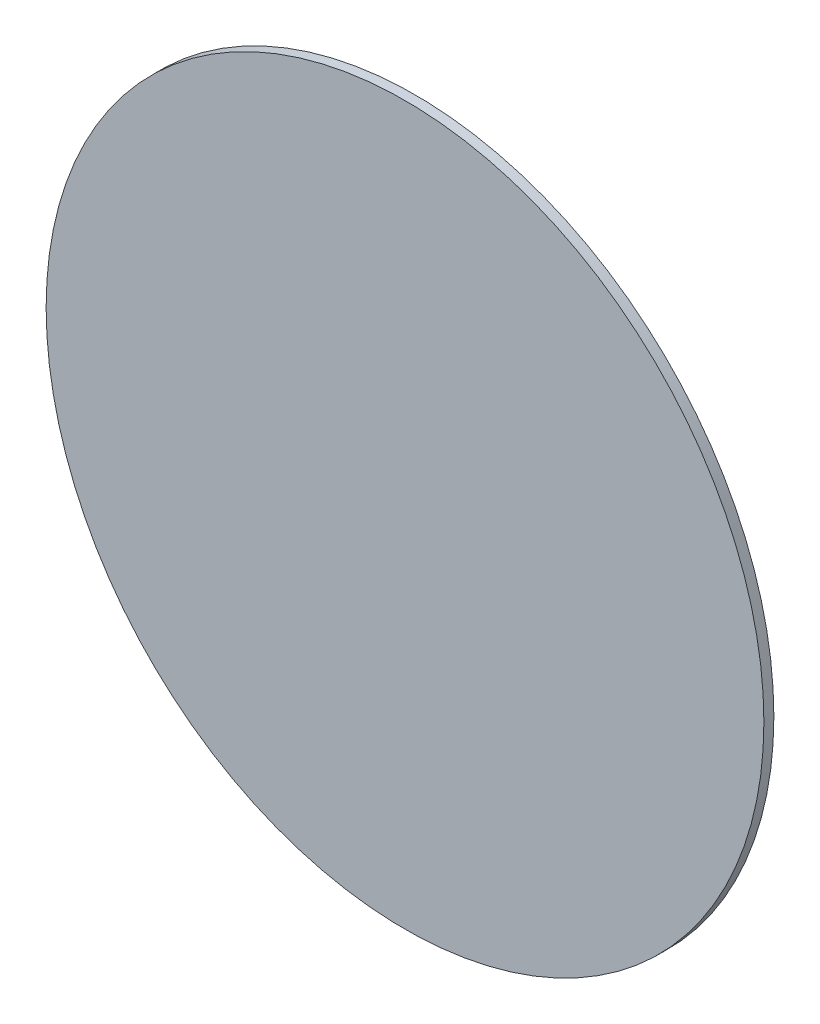
from build123d import *

# Parameters (mm, degrees)
EXTRUDE1_START = 19.05
SKETCH1_R      = 114.3
EXTRUDE1_DEPTH = 3.175


with BuildPart() as part:
    # Sketch1 → Extrude1 (new body)
    with BuildSketch(Plane.XY.offset(EXTRUDE1_START)):
        with Locations((0, 30.1625)):
            Circle(SKETCH1_R)
    extrude(amount=EXTRUDE1_DEPTH)


solid = part.part
